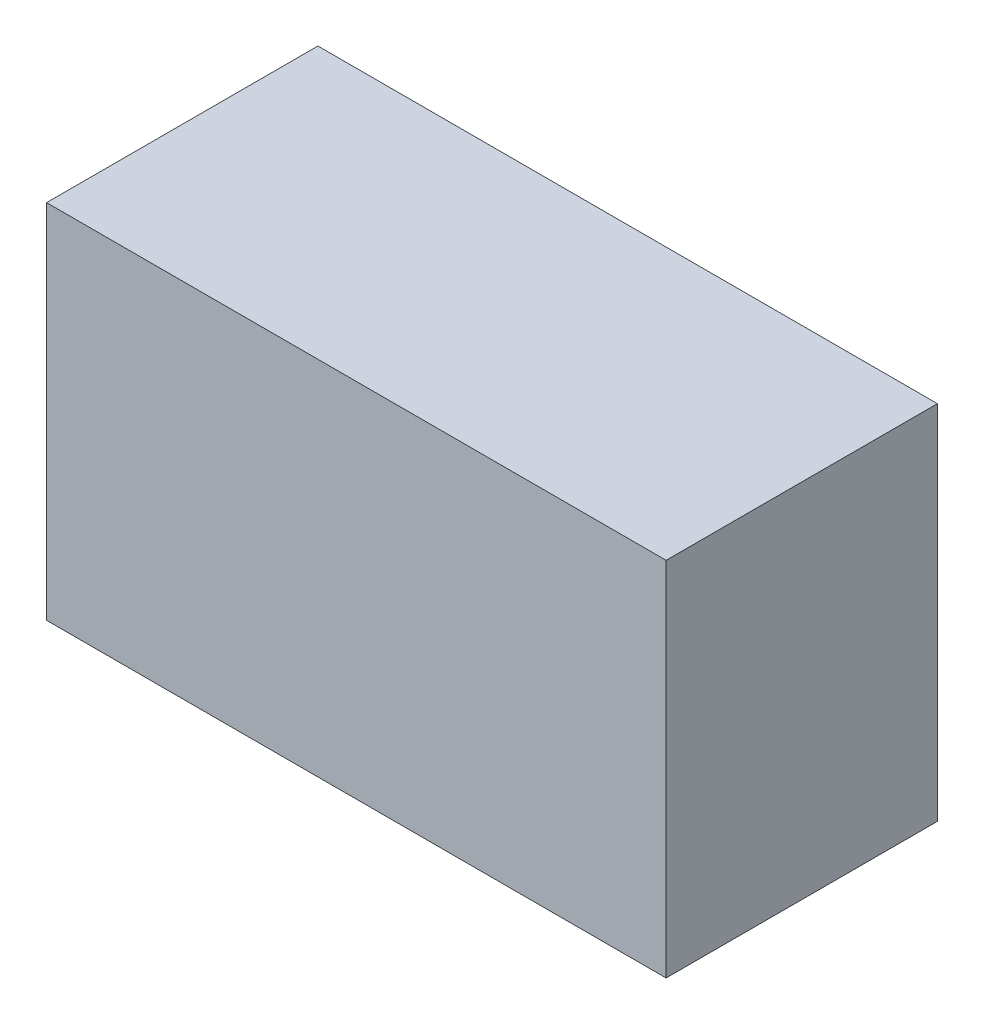
from build123d import *

# Parameters (mm, degrees)
SKETCH1_W           = 87.00008
SKETCH1_H           = 50.8
BOSS_EXTRUDE1_DEPTH = 38.1


with BuildPart() as part:
    # Sketch1 → Boss-Extrude1 (new body)
    with BuildSketch(Plane.XY):
        Rectangle(SKETCH1_W, SKETCH1_H)
    extrude(amount=BOSS_EXTRUDE1_DEPTH)


solid = part.part
